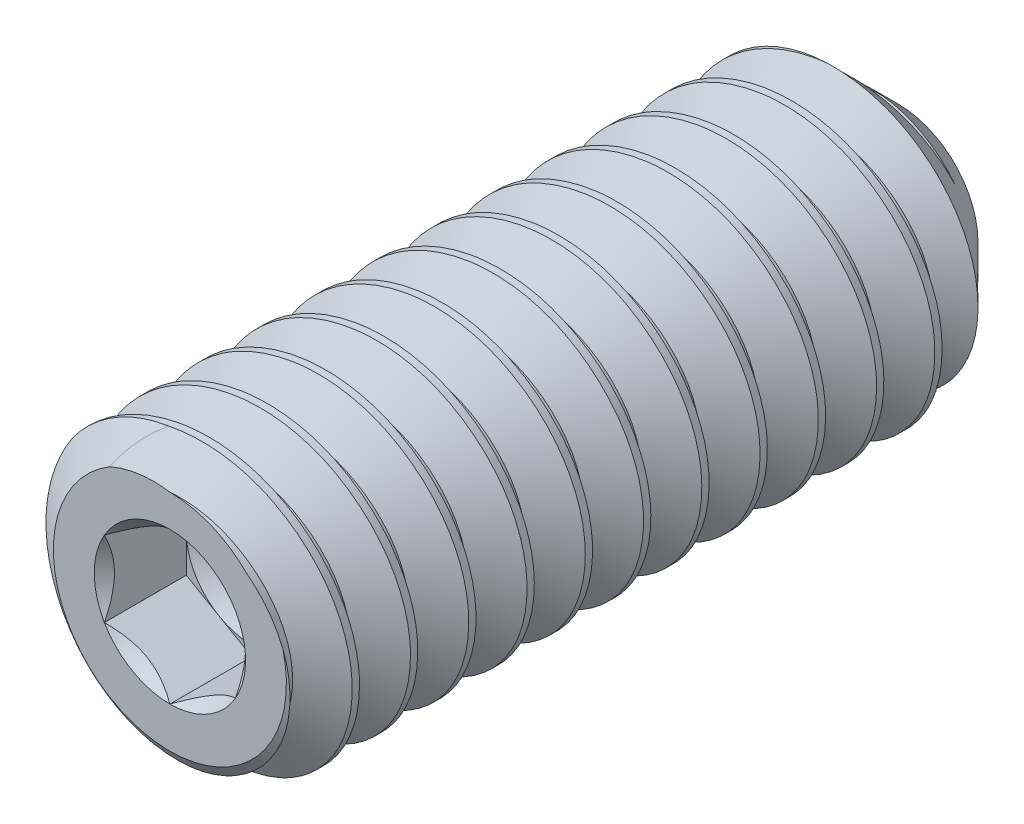
from build123d import *

# Parameters (mm, degrees)
CUT_SWEEP2_PITCH    = 0.4
CUT_EXTRUDE10_DEPTH = 0.5625


with BuildPart() as part:
    # Sketch22 → Revolve1 (revolve)
    with BuildSketch(Plane(origin=(0, 0, 0), x_dir=(0, 0, -1), z_dir=(1, 0, 0)), mode=Mode.PRIVATE) as revolve1_sk:
        Polygon((-2.335374734, 0), (-2.335374734, 0.8), (-2.195333226, 1), (2.212590173, 1), (2.664625266, 0.547964906), (2.335374734, 0), align=None)
    revolve(revolve1_sk.sketch.rotate(Axis((0, 0, -2.335374734), (0, 0, -1)), 180), axis=Axis((0, 0, -2.335374734), (0, 0, -1)))

    # Cut-Sweep2: arcs per turn and ends read off the stored shape
    # Cut-Sweep2: the profile of Sketch28 profile screwed along a right-hand helix through 13.5 turns, 6 arcs to a turn; built about Z, then put on its axis
    cut_sweep2_z = Axis((0, 0, 0), (0, 0, 1))
    cut_sweep2_corners = [(1.0003, -3.49e-07, -0.099826817), (1.0003, -3.49e-07, -0.450173227), (0.740192379, -2.58e-07, -0.300000022), (0.740192379, -2.58e-07, -0.250000022)]
    with BuildLine(mode=Mode.PRIVATE) as cut_sweep2_profile:
        Line(cut_sweep2_corners[0], cut_sweep2_corners[1])
        Line(cut_sweep2_corners[1], cut_sweep2_corners[2])
        Line(cut_sweep2_corners[2], cut_sweep2_corners[3])
        Line(cut_sweep2_corners[3], cut_sweep2_corners[0])
    cut_sweep2_cap = Face(cut_sweep2_profile.wire())
    cut_sweep2_turn_angles = [0, 30, 60, 90, 120, 150, 180, 210, 240, 270, 300, 330, 360]
    cut_sweep2_turn_weights = [1, 0.8660254037844387, 1, 0.8660254037844387, 1, 0.8660254037844387, 1, 0.8660254037844387, 1, 0.8660254037844387, 1, 0.8660254037844387, 1]
    cut_sweep2_turn_rails = [Edge.make_bspline([Vector(p[0], p[1], 0).rotate(cut_sweep2_z, cut_sweep2_turn_angles[k]) / cut_sweep2_turn_weights[k] + Vector(0, 0, p[2] + CUT_SWEEP2_PITCH * cut_sweep2_turn_angles[k] / 360) for k in range(13)], [0, 0, 0, 1, 1, 2, 2, 3, 3, 4, 4, 5, 5, 6, 6, 6], 2, cut_sweep2_turn_weights) for p in cut_sweep2_corners]
    cut_sweep2_turn_sides = [Face.make_surface_from_curves(cut_sweep2_turn_rails[p[0]], cut_sweep2_turn_rails[p[1]]) for p in [(0, 1), (1, 2), (2, 3), (3, 0)]]
    cut_sweep2_last_angles = [4680, 4710, 4740, 4770, 4800, 4830, 4860]
    cut_sweep2_last_weights = [1, 0.8660254037844387, 1, 0.8660254037844387, 1, 0.8660254037844228, 1]
    cut_sweep2_last_rails = [Edge.make_bspline([Vector(p[0], p[1], 0).rotate(cut_sweep2_z, cut_sweep2_last_angles[k]) / cut_sweep2_last_weights[k] + Vector(0, 0, p[2] + CUT_SWEEP2_PITCH * cut_sweep2_last_angles[k] / 360) for k in range(7)], [0, 0, 0, 1, 1, 2, 2, 3, 3, 3], 2, cut_sweep2_last_weights) for p in cut_sweep2_corners]
    cut_sweep2_last_sides = [Face.make_surface_from_curves(cut_sweep2_last_rails[p[0]], cut_sweep2_last_rails[p[1]]) for p in [(0, 1), (1, 2), (2, 3), (3, 0)]]
    cut_sweep2 = Plane(origin=(0, 0, -2.664625266), x_dir=(1, 0, 0), z_dir=(0, 0, 1)) * Solid(Shell([*[p.moved(Location((0, 0, CUT_SWEEP2_PITCH * i))) for i in range(13) for p in cut_sweep2_turn_sides], *cut_sweep2_last_sides, cut_sweep2_cap, cut_sweep2_cap.rotate(cut_sweep2_z, 4860).moved(Location((0, 0, CUT_SWEEP2_PITCH * 4860 / 360)))]))
    add(cut_sweep2, mode=Mode.SUBTRACT)

    # Sketch23 → Cut-Extrude10 (cut)
    with BuildSketch(Plane.XY.offset(2.335374734)):
        Polygon((0, 0.519615242), (-0.45, 0.259807621), (-0.45, -0.259807621), (0, -0.519615242), (0.45, -0.259807621), (0.45, 0.259807621), align=None)
    extrude(amount=-CUT_EXTRUDE10_DEPTH, mode=Mode.SUBTRACT)

    # Cut-Extrude11 cone 1 section (through the dimple's axis) → Cut-Extrude11 (revolve, cut)
    with BuildSketch(Plane(origin=(0, 0, 2.335374734), x_dir=(0, -1, 0), z_dir=(1, 0, 0))):
        Polygon((0, 0), (0.519615242, 0), (0, 0.519615242), align=None)
    revolve(axis=Axis((0, 0, 2.335374734), (0, 0, -1)), mode=Mode.SUBTRACT)

    # Cut-Extrude12 cone 1 section (through the dimple's axis) → Cut-Extrude12 (revolve, cut)
    with BuildSketch(Plane(origin=(0, 0, 1.772874734), x_dir=(0, -1, 0), z_dir=(1, 0, 0))):
        Polygon((0, 0), (0.45, 0), (0, 0.259807621), align=None)
    revolve(axis=Axis((0, 0, 1.772874734), (0, 0, -1)), mode=Mode.SUBTRACT)


solid = part.part
